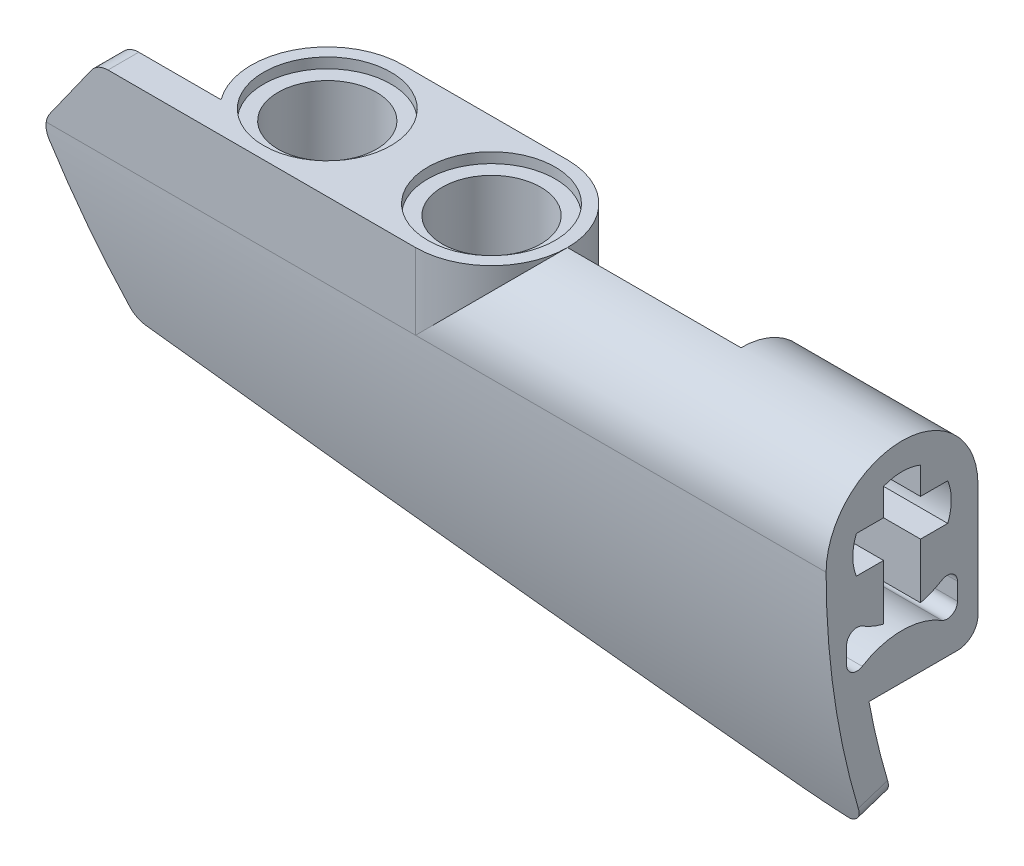
from build123d import *
from build123d.topology import SkipClean

# Parameters (mm, degrees)
F_2_BLOCK_BODY_DEPTH        = 7
AXLE_START                  = 24
SKETCH2_R                   = 3.7
AXLE_BODY_DEPTH             = 7.85
FAIRING_TOP_REACH           = 35.506
FAIRING_TOP_END_RADIUS      = 3.7
FAIRING_BOTTOM_DEPTH        = 38.2
FAIRING_SIDE_CUT_DEPTH      = 29.754999715
FAIRING_SIDE_CUT_DEPTH_BACK = 29.754999715
FAIRING_CORNER_REACH        = 43.353
FAIRING_CORNER_END_RADIUS   = 3.7
SKETCH6_W                   = 1.5
SKETCH6_H                   = 3.7
SKETCH3_W                   = 1.8
SKETCH3_H                   = 1.8
AXLE_CUT_DEPTH              = 7.85
FILLET1_R                   = 0.5
SKETCH7_R                   = 2.4
BLOCK_HOLES_DEPTH           = 7
SKETCH8_R                   = 3.1
SKETCH8_R_2                 = 2.4
RIM_CUTS_DEPTH              = 0.5
STOPPER_REACH               = 31.255
STOPPER_START_RADIUS        = 36.103557437
STOPPER_END_RADIUS          = 36.103557437
SKETCH9_W                   = 13
SKETCH9_H                   = 0.5
FILLET2_R                   = 1
FAIRING_MAIN_CUT_DEPTH      = 29.754999715
FAIRING_MAIN_CUT_DEPTH_BACK = 29.754999715
FILLET3_R                   = 5
FILLET4_R                   = 1


with BuildPart() as part:
    # Sketch1 → 2 Block Body (new body)
    with BuildSketch(Plane(origin=(0, 0, 0), x_dir=(1, 0, 0), z_dir=(0, 1, 0))):
        with BuildLine():
            Line((4, -3.7), (-4, -3.7))
            ThreePointArc((-4, -3.7), (-7.7, 0), (-4, 3.7))
            Line((-4, 3.7), (4, 3.7))
            ThreePointArc((4, 3.7), (7.7, 0), (4, -3.7))
        make_face()
    extrude(amount=-F_2_BLOCK_BODY_DEPTH)



with BuildPart() as body_2:
    # Sketch2 → Axle Body (new body)
    with BuildSketch(Plane(origin=(0, 0, 0), x_dir=(0, 0, -1), z_dir=(1, 0, 0)).offset(AXLE_START)):
        with BuildLine():
            ThreePointArc((3.7, -3.7), (0, -7.4), (-3.7, -3.7))
            Line((-3.7, -3.7), (-3.7, -10.2))
            Line((-3.7, -10.2), (3.7, -10.2))
            Line((3.7, -10.2), (3.7, -3.7))
        make_face()
        with Locations((0, -3.7)):
            Circle(SKETCH2_R)
    extrude(amount=-AXLE_BODY_DEPTH)


with BuildPart() as part_1:
    add(part.part)

    add(body_2.part)  # Fairing Top merges body 2
    # Fairing Top: up to this cylinder (the profile starts outside it)
    fairing_top_end = Plane(origin=(4, -1.781509, 0), z_dir=(0, 1, 0)) * Cylinder(FAIRING_TOP_END_RADIUS, 79.412, mode=Mode.PRIVATE)
    # Sketch4 → Fairing Top (add, up to the surface)
    with BuildSketch(Plane(origin=(24, 0, 0), x_dir=(0, 0, -1), z_dir=(1, 0, 0)), mode=Mode.PRIVATE) as fairing_top_sk1:
        with BuildLine():
            Line((0, -1.5), (0, 0))
            ThreePointArc((0, 0), (-2.61629509, -1.08370491), (-3.7, -3.7))
            Line((-3.7, -3.7), (-2.2, -3.7))
            ThreePointArc((-2.2, -3.7), (-1.555634919, -2.144365081), (0, -1.5))
        make_face()
    fairing_top_tool1 = extrude(fairing_top_sk1.sketch, amount=-FAIRING_TOP_REACH, mode=Mode.PRIVATE) - fairing_top_end
    add(fairing_top_tool1.solids().sort_by_distance((24, -1.781509, 1.918491))[0])

    # Sketch4<3> → Fairing Bottom (add)
    with BuildSketch(Plane(origin=(24, 0, 0), x_dir=(0, 0, -1), z_dir=(1, 0, 0))):
        with BuildLine():
            Line((-1.610057693, -10.2), (-3.133957759, -10.2))
            ThreePointArc((-3.133957759, -10.2), (-2.576502002, -12.823200932), (-1.833503605, -15.4))
            Line((-1.833503605, -15.4), (-0.407957853, -14.933288838))
            ThreePointArc((-0.407957853, -14.933288838), (-1.08913059, -12.586992982), (-1.610057693, -10.2))
        make_face()
        with BuildLine():
            Line((-2.2, -3.7), (-3.7, -3.7))
            ThreePointArc((-3.7, -3.7), (-3.558222165, -6.962299949), (-3.133957759, -10.2))
            Line((-3.133957759, -10.2), (-1.610057693, -10.2))
            ThreePointArc((-1.610057693, -10.2), (-2.052211942, -6.96335839), (-2.2, -3.7))
        make_face()
    extrude(amount=-FAIRING_BOTTOM_DEPTH)

    # Sketch5 → Fairing Side Cut (cut, two sides: drawn at the far end of the back side and taken through both)
    with SkipClean():  # the faces are left unmerged after this step: merging them gives an invalid solid
        with BuildSketch(Plane(origin=(0, 0, 0), x_dir=(0, 0, -1), z_dir=(1, 0, 0)).offset(-FAIRING_SIDE_CUT_DEPTH_BACK)):
            with BuildLine():
                Line((-1.833503605, -15.4), (-3.7, -15.4))
                Line((-3.7, -15.4), (-3.7, -3.7))
                ThreePointArc((-3.7, -3.7), (-3.230444229, -9.62397267), (-1.833503605, -15.4))
            make_face()
        extrude(amount=FAIRING_SIDE_CUT_DEPTH + FAIRING_SIDE_CUT_DEPTH_BACK, mode=Mode.SUBTRACT)

    # Fairing Corner: up to this cylinder (the profile starts outside it)
    fairing_corner_end = Plane(origin=(-4, -1.85, 0), z_dir=(0, 1, 0)) * Cylinder(FAIRING_CORNER_END_RADIUS, 95.106, mode=Mode.PRIVATE)
    # Sketch6 → Fairing Corner (add, up to the surface)
    with BuildSketch(Plane.ZY.offset(14.2), mode=Mode.PRIVATE) as fairing_corner_sk1:
        with Locations((2.95, -1.85)):
            Rectangle(SKETCH6_W, SKETCH6_H)
    fairing_corner_tool1 = extrude(fairing_corner_sk1.sketch, amount=-FAIRING_CORNER_REACH, mode=Mode.PRIVATE) - fairing_corner_end
    add(fairing_corner_tool1.solids().sort_by_distance((-14.2, -1.85, 2.95))[0])

    # Sketch3 → Axle Cut (cut)
    with BuildSketch(Plane(origin=(24, 0, 0), x_dir=(0, 0, -1), z_dir=(1, 0, 0))):
        with BuildLine():
            Line((-2.224859546, -4.6), (-0.9, -4.6))
            Line((-0.9, -4.6), (-0.9, -2.8))
            Line((-0.9, -2.8), (-2.224859546, -2.8))
            ThreePointArc((-2.224859546, -2.8), (-2.355808026, -3.24155857), (-2.4, -3.7))
            ThreePointArc((-2.4, -3.7), (-2.355808026, -4.15844143), (-2.224859546, -4.6))
        make_face()
        with BuildLine():
            Line((-0.9, -2.8), (0.9, -2.8))
            Line((0.9, -2.8), (0.9, -1.475140454))
            ThreePointArc((0.9, -1.475140454), (0.45844143, -1.344191974), (0, -1.3))
            ThreePointArc((0, -1.3), (-0.45844143, -1.344191974), (-0.9, -1.475140454))
            Line((-0.9, -1.475140454), (-0.9, -2.8))
        make_face()
        with Locations((0, -3.7)):
            Rectangle(SKETCH3_W, SKETCH3_H)
        with BuildLine():
            Line((0.9, -5.924859546), (0.9, -4.6))
            Line((0.9, -4.6), (-0.9, -4.6))
            Line((-0.9, -4.6), (-0.9, -5.924859546))
            ThreePointArc((-0.9, -5.924859546), (-0.45844143, -6.055808026), (0, -6.1))
            ThreePointArc((0, -6.1), (0.45844143, -6.055808026), (0.9, -5.924859546))
        make_face()
        with BuildLine():
            Line((0.9, -4.6), (2.224859546, -4.6))
            ThreePointArc((2.224859546, -4.6), (2.355808026, -4.15844143), (2.4, -3.7))
            ThreePointArc((2.4, -3.7), (2.355808026, -3.24155857), (2.224859546, -2.8))
            Line((2.224859546, -2.8), (0.9, -2.8))
            Line((0.9, -2.8), (0.9, -4.6))
        make_face()
        with BuildLine():
            Line((0.9, -7.288871689), (0.9, -6.1))
            Line((0.9, -6.1), (0, -6.1))
            Line((0, -6.1), (-0.9, -6.1))
            Line((-0.9, -6.1), (-0.9, -7.288871689))
            ThreePointArc((-0.9, -7.288871689), (0, -7.4), (0.9, -7.288871689))
        make_face()
        with BuildLine():
            Line((-0.9, -6.1), (0, -6.1))
            ThreePointArc((0, -6.1), (-0.45844143, -6.055808026), (-0.9, -5.924859546))
            Line((-0.9, -5.924859546), (-0.9, -6.1))
        make_face()
        with BuildLine():
            Line((0.9, -6.1), (0.9, -5.924859546))
            ThreePointArc((0.9, -5.924859546), (0.45844143, -6.055808026), (0, -6.1))
            Line((0, -6.1), (0.9, -6.1))
        make_face()
        with BuildLine():
            ThreePointArc((2.7, -6.229822128), (1.876271967, -6.888981578), (0.9, -7.288871689))
            ThreePointArc((0.9, -7.288871689), (0, -7.4), (-0.9, -7.288871689))
            ThreePointArc((-0.9, -7.288871689), (-1.876271967, -6.888981578), (-2.7, -6.229822128))
            Line((-2.7, -6.229822128), (-2.7, -9.170177872))
            ThreePointArc((-2.7, -9.170177872), (0, -8), (2.7, -9.170177872))
            Line((2.7, -9.170177872), (2.7, -6.229822128))
        make_face()
    extrude(amount=-AXLE_CUT_DEPTH, mode=Mode.SUBTRACT)

    # Fillet1
    # the kernel refuses this fillet: 0.5 mm, written as the material it adds along each edge
    with BuildSketch(Plane(origin=(24, -6.229822128, -2.7), x_dir=(0, -1, 0), z_dir=(-1, 0, 0))) as fillet1_piece_1:
        with BuildLine():
            CenterArc((1.047886636, 0.5), FILLET1_R, 148.411864495, 121.588135505)
            ThreePointArc((0.621968926, 0.761904762), (0.336413522, 0.36019377), (0, 0))
            Line((0, 0), (1.047886636, 0))
        make_face()
    extrude(amount=7.85)
    with BuildSketch(Plane(origin=(24, -9.170177872, -2.7), x_dir=(0, 0.6323800622573651, 0.7746582839287082), z_dir=(-1, 0, 0)), Plane(origin=(24, -6.229822128, 2.7), x_dir=(0, -0.6323800622573447, -0.7746582839287249), z_dir=(-1, 0, 0))) as fillet1_piece_2:
        with BuildLine():
            CenterArc((1.049991758, 0.495564032), FILLET1_R, 140.774061683, 121.588135505)
            Line((0.662662616, 0.811754063), (0, 0))
            ThreePointArc((0, 0), (0.491768292, 0.032826163), (0.983536583, 0))
        make_face()
    extrude(amount=7.85)
    with BuildSketch(Plane(origin=(24, -9.170177872, 2.7), x_dir=(0, 1, 0), z_dir=(-1, 0, 0))) as fillet1_piece_3:
        with BuildLine():
            CenterArc((1.047886636, 0.5), FILLET1_R, 148.411864495, 121.588135505)
            ThreePointArc((0.621968926, 0.761904762), (0.336413522, 0.36019377), (0, 0))
            Line((0, 0), (1.047886636, 0))
        make_face()
    extrude(amount=10.46971659)

    # Sketch7 → Block Holes (cut)
    with BuildSketch(Plane(origin=(0, 0, 0), x_dir=(1, 0, 0), z_dir=(0, 1, 0))):
        with Locations(Location((-4, 0, 0), (0, 0, 270))):
            Circle(SKETCH7_R)
        with Locations(Location((4, 0, 0), (0, 0, 270))):
            Circle(SKETCH7_R)
    extrude(amount=-BLOCK_HOLES_DEPTH, mode=Mode.SUBTRACT)

    # Sketch8 → Rim Cuts (cut)
    # profile 1 of 2: a face of its own
    with BuildSketch(Plane(origin=(0, 0, 0), x_dir=(1, 0, 0), z_dir=(0, 1, 0))):
        with Locations(Location((-4, 0, 0), (0, 0, 270))):
            Circle(SKETCH8_R)
        with Locations(Location((-4, 0, 0), (0, 0, 270))):
            Circle(SKETCH8_R_2, mode=Mode.SUBTRACT)
    # profile 2 of 2: a face of its own
    with BuildSketch(Plane(origin=(0, 0, 0), x_dir=(1, 0, 0), z_dir=(0, 1, 0))):
        with Locations(Location((4, 0, 0), (0, 0, 270))):
            Circle(SKETCH8_R)
        with Locations(Location((4, 0, 0), (0, 0, 270))):
            Circle(SKETCH8_R_2, mode=Mode.SUBTRACT)
    extrude(amount=-RIM_CUTS_DEPTH, mode=Mode.SUBTRACT)

    # Stopper: from a cylinder face, 31.255 long prism both ways, kept between that surface and its translate by the depth
    stopper_start = Plane(origin=(0, -3.7, -33.903557437), z_dir=(1, 0, 0)) * Cylinder(STOPPER_START_RADIUS, 135.717114875, mode=Mode.PRIVATE)
    stopper_end = Plane(origin=(0, -3.7, -34.403557437), z_dir=(1, 0, 0)) * Cylinder(STOPPER_END_RADIUS, 135.717114875, mode=Mode.PRIVATE)
    # Sketch9 → Stopper (add, from a surface)
    with BuildSketch(Plane.XY, mode=Mode.PRIVATE) as stopper_sk1:
        with Locations((0, -7.75)):
            Rectangle(SKETCH9_W, SKETCH9_H)
    stopper_tool1 = extrude(stopper_sk1.sketch, amount=STOPPER_REACH, both=True, mode=Mode.PRIVATE)
    add(((stopper_tool1 & stopper_start) - stopper_end).solids().sort_by_distance((0, -7.75, 1.72124))[0])

    # Fillet2
    fillet2_edges = [part_1.edges().sort_by_distance(p)[0] for p in [
        (24, -15.166644419, 1.120730729),
    ]]
    fillet(fillet2_edges, radius=FILLET2_R)

    # Sketch10 → Fairing Main Cut (cut, two sides: drawn at the far end of the back side and taken through both)
    with BuildSketch(Plane.XY.offset(-FAIRING_MAIN_CUT_DEPTH_BACK)):
        Polygon((-14.2, -3.8), (-14.2, 0), (-11.5, 0), align=None)
        Polygon((23, -15.4), (-10.2, -10.4), (-14.2, -3.8), (-14.2, -15.4), align=None)
    extrude(amount=FAIRING_MAIN_CUT_DEPTH + FAIRING_MAIN_CUT_DEPTH_BACK, mode=Mode.SUBTRACT)

    # Fillet3
    # the kernel refuses this fillet: 5 mm, written as the material it takes off along each edge
    with BuildSketch(Plane(origin=(24.982656407, -15.698592832, 2.745540381), x_dir=(-0.40943647865659716, 0.061662120279605645, 0.9102524665541475), z_dir=(-0.900102053497931, 0.1355575381773993, -0.41405367663153375))) as fillet3_piece_1:
        with BuildLine():
            CenterArc((FILLET3_R * 0.17621614345, FILLET3_R), FILLET3_R, 250.012318265, 19.987681735)
            Line((-FILLET3_R * 0.165601963428, FILLET3_R * 0.0602338685556), (-FILLET3_R * 0.172438325566, FILLET3_R * 0.0414385459267))
            Line((-FILLET3_R * 0.172438325566, FILLET3_R * 0.0414385459267), (-FILLET3_R * 0.003524322869, -FILLET3_R * 0.02))
            Line((-FILLET3_R * 0.003524322869, -FILLET3_R * 0.02), (FILLET3_R * 0.17621614345, -FILLET3_R * 0.02))
            Line((FILLET3_R * 0.17621614345, -FILLET3_R * 0.02), (FILLET3_R * 0.17621614345, 0))
        make_face()
    extrude(amount=7.848304428, mode=Mode.SUBTRACT)

    # Fillet4
    fillet4_edges = [part_1.edges().sort_by_distance(p)[0] for p in [
        (-11.5, 0, 2.95),
        (-10.2, -10.4, 2.335585217),
        (-14.2, -3.8, 2.949864271),
        (20.075, -10.2, -3.7),
    ]]
    fillet(fillet4_edges, radius=FILLET4_R)


solid = part_1.part
